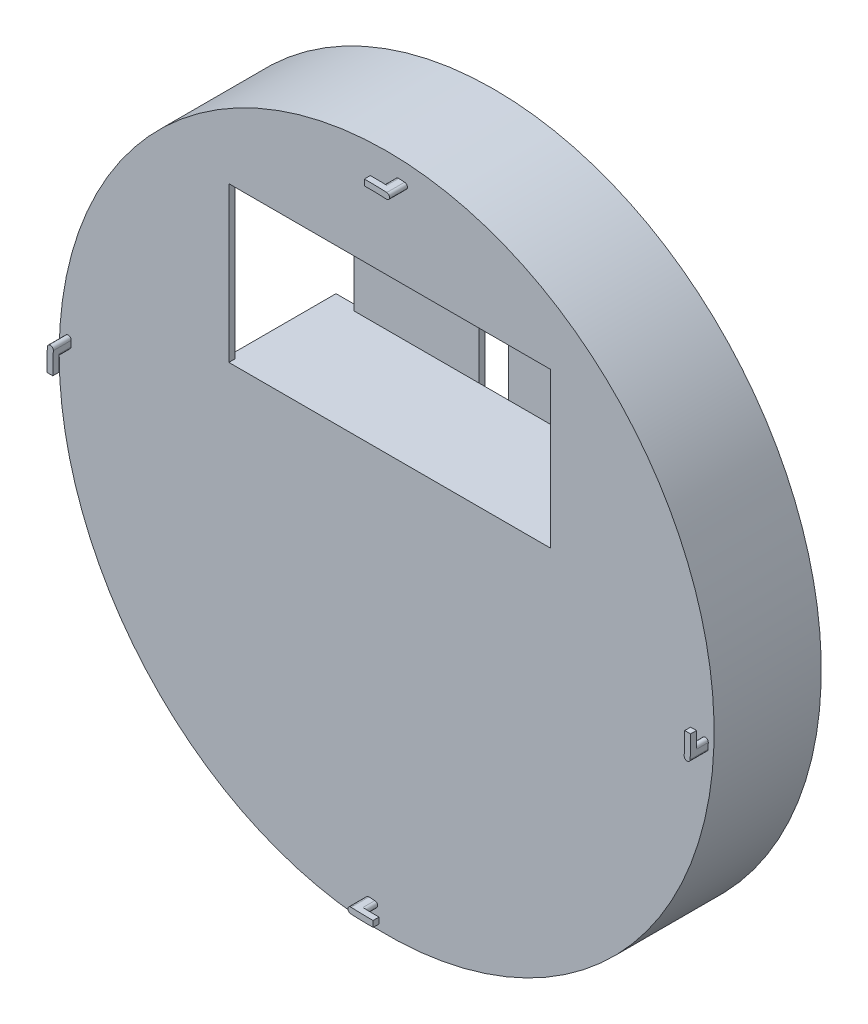
from build123d import *

# Parameters (mm, degrees)
ESQUISSE1_RX                 = 57
ESQUISSE1_RY                 = 55
BOSS_EXTRU_1_DEPTH           = 18
ESQUISSE2_R                  = 50
ENL_V_MAT_EXTRU_1_DEPTH      = 17
ESQUISSE3_W                  = 56
ESQUISSE3_H                  = 28
BOSS_EXTRU_2_DEPTH           = 18
ESQUISSE4_W                  = 54
ESQUISSE4_H                  = 26
ENL_V_MAT_EXTRU_2_DEPTH      = 18
ESQUISSE5_W                  = 5
ESQUISSE5_H                  = 28
ENL_V_MAT_EXTRU_3_DEPTH      = 1
ENL_V_MAT_EXTRU_4_DEPTH      = 5
BOSS_EXTRU_3_DEPTH           = 10
ESQUISSE9_W                  = 4
ESQUISSE9_H                  = 26
ENL_V_MAT_EXTRU_5_DEPTH      = 18
ESQUISSE10_R                 = 3
BOSS_EXTRU_4_DEPTH           = 15
BOSS_EXTRU_5_DEPTH           = 3
ESQUISSE12_W                 = 1
ESQUISSE12_H                 = 1
R_VOLUTION1_ANGLE            = 4
R_P_TITION_CIRCULAIRE1_COUNT = 4


with BuildPart() as part:
    # Esquisse1 → Boss.-Extru.1 (new body)
    with BuildSketch(Plane.XY):
        with Locations(Location((0, 0), (0, 0, 90))):
            Ellipse(ESQUISSE1_RX, ESQUISSE1_RY)
    extrude(amount=BOSS_EXTRU_1_DEPTH)

    # Esquisse2 → Enlèv. mat.-Extru.1 (cut)
    with BuildSketch(Plane(origin=(0, 0, 0), x_dir=(-1, 0, 0), z_dir=(0, 0, -1))):
        Circle(ESQUISSE2_R)
    extrude(amount=-ENL_V_MAT_EXTRU_1_DEPTH, mode=Mode.SUBTRACT)

    # Esquisse3 → Boss.-Extru.2 (add)
    with BuildSketch(Plane(origin=(0, 0, 17), x_dir=(-1, 0, 0), z_dir=(0, 0, -1))):
        with Locations((-0.5, 26)):
            Rectangle(ESQUISSE3_W, ESQUISSE3_H)
    extrude(amount=BOSS_EXTRU_2_DEPTH)

    # Esquisse4 → Enlèv. mat.-Extru.2 (cut)
    with BuildSketch(Plane.XY.offset(18)):
        with Locations((0.5, 26)):
            Rectangle(ESQUISSE4_W, ESQUISSE4_H)
    extrude(amount=-ENL_V_MAT_EXTRU_2_DEPTH, mode=Mode.SUBTRACT)

    # Esquisse5 → Enlèv. mat.-Extru.3 (cut)
    with BuildSketch(Plane(origin=(0, 0, -1), x_dir=(-1, 0, 0), z_dir=(0, 0, -1))):
        with Locations((0, 26)):
            Rectangle(ESQUISSE5_W, ESQUISSE5_H)
    extrude(amount=-ENL_V_MAT_EXTRU_3_DEPTH, mode=Mode.SUBTRACT)

    # Esquisse7 → Enlèv. mat.-Extru.4 (cut)
    with BuildSketch(Plane.ZY.offset(-2.5)):
        Polygon((-1, 40), (-1, 12), (3, 40), align=None)
    extrude(amount=ENL_V_MAT_EXTRU_4_DEPTH, mode=Mode.SUBTRACT)

    # Esquisse8 → Boss.-Extru.3 (add)
    with BuildSketch(Plane(origin=(0, 0, 17), x_dir=(-1, 0, 0), z_dir=(0, 0, -1))):
        Polygon((-5.5, 46), (-5.5, 40), (-2, 40), (-2, 41), (-4.5, 41), (-4.5, 45), (-2, 45), (-2, 46), align=None)
        Polygon((5.5, 46), (5.5, 40), (2, 40), (2, 41), (4.5, 41), (4.5, 45), (2, 45), (2, 46), align=None)
    extrude(amount=BOSS_EXTRU_3_DEPTH)

    # Esquisse9 → Enlèv. mat.-Extru.5 (cut)
    with BuildSketch(Plane(origin=(0, 0, -1), x_dir=(-1, 0, 0), z_dir=(0, 0, -1))):
        with Locations((25.5, 26)):
            Rectangle(ESQUISSE9_W, ESQUISSE9_H)
    extrude(amount=-ENL_V_MAT_EXTRU_5_DEPTH, mode=Mode.SUBTRACT)

    # Esquisse10 → Boss.-Extru.4 (add)
    with BuildSketch(Plane(origin=(0, 0, -1), x_dir=(-1, 0, 0), z_dir=(0, 0, -1))):
        with Locations((-9.5, 26)):
            Circle(ESQUISSE10_R)
        with Locations((9.5, 26)):
            Circle(ESQUISSE10_R)
    extrude(amount=BOSS_EXTRU_4_DEPTH)

    # Esquisse11 → Boss.-Extru.5 (add)
    with BuildSketch(Plane.XY.offset(18)):
        with BuildLine():
            ThreePointArc((-53.973512996, 3.028006819), (-53.999454946, 2.523449222), (-54.020680271, 2.018671213))
            ThreePointArc((-54.020680271, 2.018671213), (-53.53970022, 1.500348736), (-53.021377743, 1.981328787))
            ThreePointArc((-53.021377743, 1.981328787), (-53.000545054, 2.476769152), (-52.975082992, 2.971993181))
            ThreePointArc((-52.975082992, 2.971993181), (-53.446291175, 3.499215002), (-53.973512996, 3.028006819))
        make_face()
        with BuildLine():
            ThreePointArc((3.028006819, 53.973512996), (2.523449222, 53.999454946), (2.018671213, 54.020680271))
            ThreePointArc((2.018671213, 54.020680271), (1.500348736, 53.53970022), (1.981328787, 53.021377743))
            ThreePointArc((1.981328787, 53.021377743), (2.476769152, 53.000545054), (2.971993181, 52.975082992))
            ThreePointArc((2.971993181, 52.975082992), (3.499215002, 53.446291175), (3.028006819, 53.973512996))
        make_face()
        with BuildLine():
            ThreePointArc((53.973512996, -3.028006819), (53.999454946, -2.523449222), (54.020680271, -2.018671213))
            ThreePointArc((54.020680271, -2.018671213), (53.53970022, -1.500348736), (53.021377743, -1.981328787))
            ThreePointArc((53.021377743, -1.981328787), (53.000545054, -2.476769152), (52.975082992, -2.971993181))
            ThreePointArc((52.975082992, -2.971993181), (53.446291175, -3.499215002), (53.973512996, -3.028006819))
        make_face()
        with BuildLine():
            ThreePointArc((-3.028006819, -53.973512996), (-2.523449222, -53.999454946), (-2.018671213, -54.020680271))
            ThreePointArc((-2.018671213, -54.020680271), (-1.500348736, -53.53970022), (-1.981328787, -53.021377743))
            ThreePointArc((-1.981328787, -53.021377743), (-2.476769152, -53.000545054), (-2.971993181, -52.975082992))
            ThreePointArc((-2.971993181, -52.975082992), (-3.499215002, -53.446291175), (-3.028006819, -53.973512996))
        make_face()
    extrude(amount=BOSS_EXTRU_5_DEPTH)

    # Esquisse12 → Révolution1 (revolve)
    with BuildSketch(Plane(origin=(0, 0, 0), x_dir=(0.9984300036919169, -0.05601363876556149, 0), z_dir=(0.056013638765561494, 0.998430003691917, 0))):
        with Locations((-53.55838446, -20.5)):
            Rectangle(ESQUISSE12_W, ESQUISSE12_H)
    r_volution1 = revolve(axis=Axis((0, 0, 17), (0, 0, 1)), revolution_arc=R_VOLUTION1_ANGLE)

    # Répétition circulaire1: Révolution1 ×4 about axis
    r_p_tition_circulaire1_axis = Axis((0, 0, 17), (0, 0, -1))
    for i in range(1, R_P_TITION_CIRCULAIRE1_COUNT):
        add(r_volution1.rotate(r_p_tition_circulaire1_axis, i * 360 / R_P_TITION_CIRCULAIRE1_COUNT))


solid = part.part
